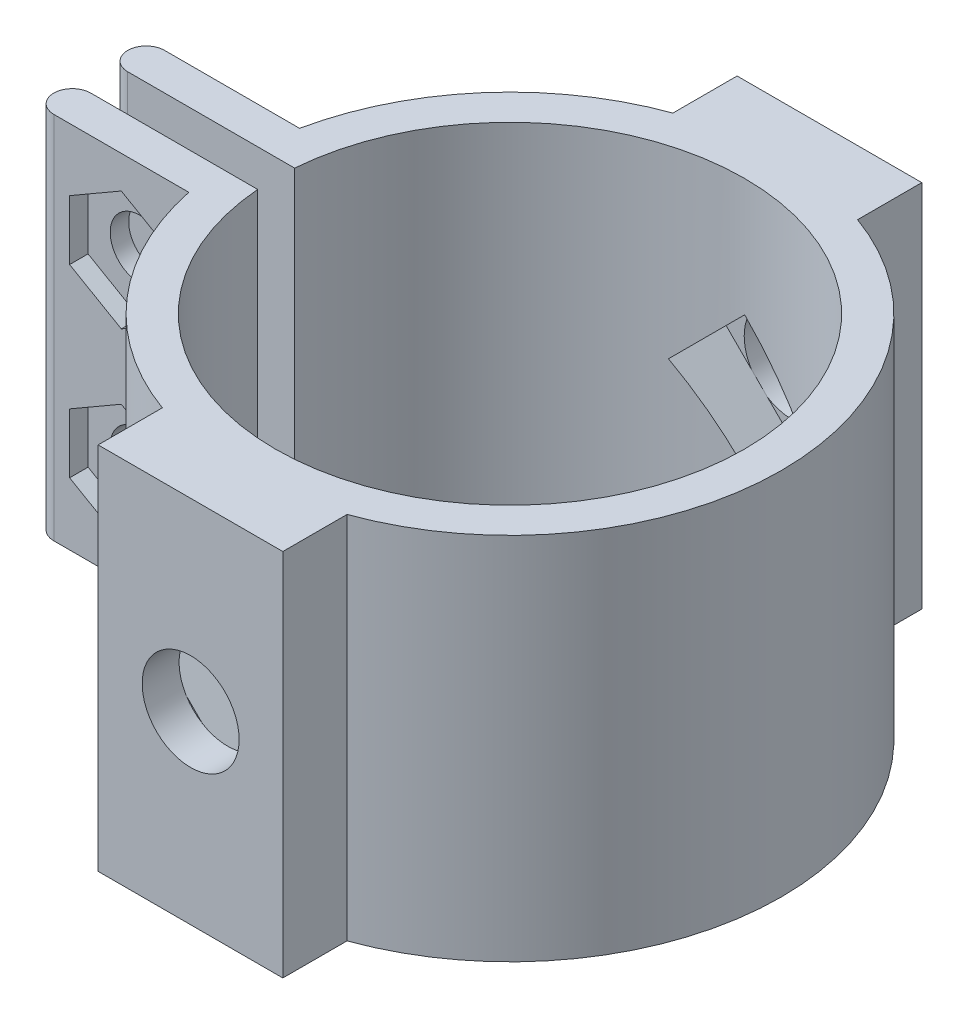
from build123d import *

# Parameters (mm, degrees)
BOSS_EXTRUDE1_DEPTH      = 10
CUT_EXTRUDE10_REACH      = 46.578
CUT_EXTRUDE10_END_RADIUS = 12.7
CUT_EXTRUDE10_START      = -2
SKETCH8_R                = 2.625
CUT_EXTRUDE11_DEPTH      = 2
CUT_EXTRUDE12_DEPTH      = 1
CUT_EXTRUDE13_REACH      = 33.436
SKETCH10_R               = 1.6


# Read off the part's stored shape, not the designer's step: Mirror2
with BuildPart() as part:
    # Sketch1 → Boss-Extrude1 (new, symmetric)
    with BuildSketch(Plane(origin=(0, 0, 0), x_dir=(1, 0, 0), z_dir=(0, 1, 0))):
        with BuildLine():
            Line((-12.709296078, -1.000053339), (-21.709296078, -1.000053339))
            ThreePointArc((-21.709296078, -1.000053339), (-22.709296078, -2.000053339), (-21.709296078, -3.000053339))
            Line((-21.709296078, -3.000053339), (-14.399918025, -3.000053339))
            ThreePointArc((-14.399918025, -3.000053339), (14.690703922, -5.3339e-05), (-14.399918025, 2.999946661))
            Line((-14.399918025, 2.999946661), (-21.709296078, 2.999946661))
            ThreePointArc((-21.709296078, 2.999946661), (-22.709296078, 1.999946661), (-21.709296078, 0.999946661))
            Line((-21.709296078, 0.999946661), (-12.709296078, 0.999946661))
            Line((-12.709296078, 0.999946661), (-12.669864786, 0.999946661))
            ThreePointArc((-12.669864786, 0.999946661), (12.690703922, -5.3339e-05), (-12.669864786, -1.000053339))
            Line((-12.669864786, -1.000053339), (-12.709296078, -1.000053339))
        make_face()
        with BuildLine():
            ThreePointArc((4.990703922, -13.823584002), (-0.009296078, -14.700053339), (-5.009296078, -13.823584002))
            Line((-5.009296078, -13.823584002), (-5.009296078, -14.750053339))
            Line((-5.009296078, -14.750053339), (-5.009296078, -17.300053339))
            Line((-5.009296078, -17.300053339), (4.990703922, -17.300053339))
            Line((4.990703922, -17.300053339), (4.990703922, -14.750053339))
            Line((4.990703922, -14.750053339), (4.990703922, -13.823584002))
        make_face()
        with BuildLine():
            Line((-5.009296078, 14.749946661), (-5.009296078, 13.823477324))
            ThreePointArc((-5.009296078, 13.823477324), (-0.009296078, 14.699946661), (4.990703922, 13.823477324))
            Line((4.990703922, 13.823477324), (4.990703922, 14.749946661))
            Line((4.990703922, 14.749946661), (4.990703922, 17.299946661))
            Line((4.990703922, 17.299946661), (-5.009296078, 17.299946661))
            Line((-5.009296078, 17.299946661), (-5.009296078, 14.749946661))
        make_face()
    extrude(amount=BOSS_EXTRUDE1_DEPTH, both=True)

    # Cut-Extrude10: up to this cylinder (the profile starts outside it)
    cut_extrude10_end = Plane(origin=(-0.009296078, 0, 5.3339e-05), z_dir=(0, -1, 0)) * Cylinder(CUT_EXTRUDE10_END_RADIUS, 119.556, mode=Mode.PRIVATE)
    # Sketch7 → Cut-Extrude10 (cut, up to the surface)
    with BuildSketch(Plane.XY.offset(17.300053339).offset(CUT_EXTRUDE10_START), mode=Mode.PRIVATE) as cut_extrude10_sk1:
        Polygon((0, 3.606244584), (-3.606244584, 0), (0, -3.606244584), (3.606244584, 0), align=None)
    cut_extrude10_tool1 = extrude(cut_extrude10_sk1.sketch, amount=-CUT_EXTRUDE10_REACH, mode=Mode.PRIVATE) - cut_extrude10_end
    add(cut_extrude10_tool1.solids().sort_by_distance((0, 0, 15.300053))[0], mode=Mode.SUBTRACT)

    # Sketch8 → Cut-Extrude11 (cut)
    with BuildSketch(Plane.XY.offset(17.300053339)):
        Circle(SKETCH8_R)
    extrude(amount=-CUT_EXTRUDE11_DEPTH, mode=Mode.SUBTRACT)

    # Mirror2
    split(bisect_by=Plane.XY, keep=Keep.TOP)

    # Mirror2 2: part across plane


with BuildPart() as part_1:
    add(part.part)
    add(part.part.mirror(Plane.XY))

    # Sketch9 → Cut-Extrude12 (cut)
    with BuildSketch(Plane.XY.offset(3.000053339)):
        Polygon((-18.054607052, 8.233161507), (-20.854607052, 6.616580754), (-20.854607052, 3.383419246), (-18.054607052, 1.766838493), (-15.254607052, 3.383419246), (-15.254607052, 6.616580754), align=None)
        Polygon((-18.054607052, -1.766838493), (-20.854607052, -3.383419246), (-20.854607052, -6.616580754), (-18.054607052, -8.233161507), (-15.254607052, -6.616580754), (-15.254607052, -3.383419246), align=None)
    extrude(amount=-CUT_EXTRUDE12_DEPTH, mode=Mode.SUBTRACT)

    # Cut-Extrude13: up to this face of the body (flat: up to its plane)
    cut_extrude13_end = Plane(part_1.part.faces().sort_by_distance((-18.054607052, 0, -3.000053339))[0])
    # Sketch10 → Cut-Extrude13 (cut, up to the picked face)
    with BuildSketch(Plane.XY.offset(2.000053339), mode=Mode.PRIVATE) as cut_extrude13_sk1:
        with Locations((-18.054607052, 5)):
            Circle(SKETCH10_R)
    cut_extrude13_tool1 = split(extrude(cut_extrude13_sk1.sketch, amount=-CUT_EXTRUDE13_REACH, mode=Mode.PRIVATE), bisect_by=cut_extrude13_end, keep=Keep.BOTH, mode=Mode.PRIVATE)
    # Sketch10 → Cut-Extrude13 (cut, up to the picked face)
    with BuildSketch(Plane.XY.offset(2.000053339), mode=Mode.PRIVATE) as cut_extrude13_sk2:
        with Locations((-18.054607052, -5)):
            Circle(SKETCH10_R)
    cut_extrude13_tool2 = split(extrude(cut_extrude13_sk2.sketch, amount=-CUT_EXTRUDE13_REACH, mode=Mode.PRIVATE), bisect_by=cut_extrude13_end, keep=Keep.BOTH, mode=Mode.PRIVATE)
    add(cut_extrude13_tool1.solids().sort_by(Axis((-18.054607, 5, 2.000053), (0, 0, -1)))[0], mode=Mode.SUBTRACT)
    add(cut_extrude13_tool2.solids().sort_by(Axis((-18.054607, -5, 2.000053), (0, 0, -1)))[0], mode=Mode.SUBTRACT)


solid = part_1.part
